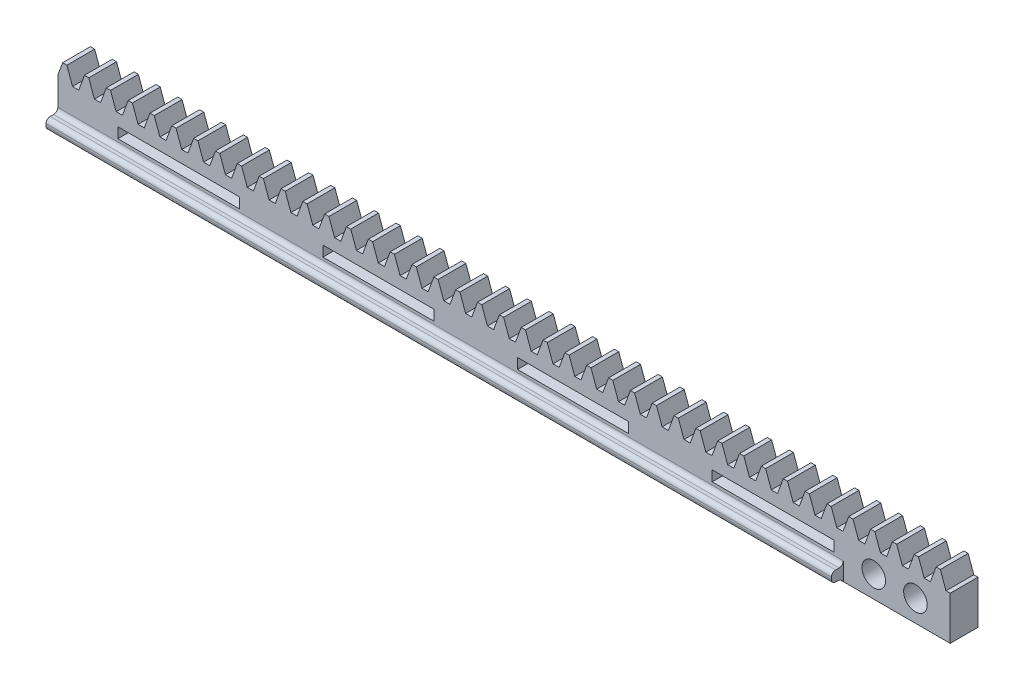
from build123d import *

# Parameters (mm, degrees)
BLANKSKE_W                      = 185.5
BLANKSKE_H                      = 7.5
BLANK_DEPTH                     = 4
TOOTHCUTSIM_DEPTH               = 186.694641818
TEETHCUTS_COUNT                 = 60
TEETHCUTS_PITCH                 = 3.14159265
BASE_LINE_W                     = 185.5
BASE_LINE_H                     = 1
BASE_DEPTH                      = 4
NOTCH_2_W                       = 103
NOTCH_2_H                       = 1.5
NOTCH_DEPTH                     = 186.694641818
FINAL_CUT_2_W                   = 49.706746588
FINAL_CUT_2_H                   = 22.249398493
FINAL_CUT_DEPTH                 = 10
RAIL_2_W                        = 113
RAIL_2_H                        = 1.5
RAIL_DEPTH                      = 1.7
VERRUNDUNG2_R                   = 1
VERRUNDUNG3_R                   = 0.6
VERRUNDUNG4_R                   = 0.6
VERRUNDUNG5_R                   = 0.6
FILLET_2_W                      = 12
FILLET_2_H                      = 1.5
FILLETO_DEPTH                   = 4
LINEARES_MUSTER1_COUNT          = 2
LINEARES_MUSTER1_PITCH          = 28
LINEARES_MUSTER2_COUNT          = 2
LINEARES_MUSTER2_PITCH          = 28
SKIZZE2_W                       = 16.998912502
SKIZZE2_H                       = 14.439985467
SCHNITT_LINEAR_AUSTRAGEN1_DEPTH = 139.646843329
SKIZZE3_R                       = 1.7
SCHNITT_LINEAR_AUSTRAGEN2_DEPTH = 139.646843329


with BuildPart() as part:
    # BlankSke → Blank (new body)
    with BuildSketch(Plane.XY):
        with Locations((92.75, 3.75)):
            Rectangle(BLANKSKE_W, BLANKSKE_H)
    extrude(amount=-BLANK_DEPTH)

    # TooCutSkeSim → ToothCutSim (cut, through all)
    with BuildSketch(Plane.XY):
        Polygon((0.44443537, 5.25), (-0.44443537, 5.25), (-1.272613241, 7.5254), (1.272613241, 7.5254), align=None)
    toothcutsim = extrude(amount=-TOOTHCUTSIM_DEPTH, mode=Mode.SUBTRACT)

    # TeethCuts: ToothCutSim ×60
    with Locations(*[(i * TEETHCUTS_PITCH, 0, 0) for i in range(1, TEETHCUTS_COUNT)]):
        add(toothcutsim, mode=Mode.SUBTRACT)

    # base-line → base (add)
    with BuildSketch(Plane.XY):
        with Locations((92.75, -0.5)):
            Rectangle(BASE_LINE_W, BASE_LINE_H)
    extrude(amount=-BASE_DEPTH)

    # notch 2 → notch (cut, through all)
    with BuildSketch(Plane.XY):
        with Locations((70.135961003, 2.75)):
            Rectangle(NOTCH_2_W, NOTCH_2_H)
    extrude(amount=-NOTCH_DEPTH, mode=Mode.SUBTRACT)

    # final cut 2 → final-cut (cut)
    with BuildSketch(Plane.XY):
        with Locations((163.239417262, 1.832076948)):
            Rectangle(FINAL_CUT_2_W, FINAL_CUT_2_H)
    extrude(amount=-FINAL_CUT_DEPTH, mode=Mode.SUBTRACT)

    # rail 2 → rail (add)
    with BuildSketch(Plane.XY):
        with Locations((66.5, 0.25)):
            Rectangle(RAIL_2_W, RAIL_2_H)
    extrude(amount=RAIL_DEPTH)

    # Verrundung2
    # the kernel refuses this fillet: 1 mm, written as the material it adds along each edge
    with BuildSketch(Plane(origin=(123, -0.5, 0), x_dir=(0, -1, 0), z_dir=(-1, 0, 0))) as verrundung2_piece_1:
        with BuildLine():
            CenterArc((1, 0.866025404), VERRUNDUNG2_R, 180, 60)
            Line((0, 0.866025404), (-0.02, 0.866025404))
            Line((-0.02, 0.866025404), (-0.02, 0))
            Line((-0.02, 0), (0, -0.02))
            ThreePointArc((0, -0.02), (0.25, -0.02), (0.49, -0.017320508))
            Line((0.49, -0.017320508), (0.5, 0))
        make_face()
    extrude(amount=113)

    # Verrundung3
    verrundung3_edges = [part.edges().sort_by_distance(p)[0] for p in [
        (66.5, -0.5, 1.7),
    ]]
    fillet(verrundung3_edges, radius=VERRUNDUNG3_R)

    # Verrundung4
    verrundung4_edges = [part.edges().sort_by_distance(p)[0] for p in [
        (66.5, 1, 0),
    ]]
    fillet(verrundung4_edges, radius=VERRUNDUNG4_R)

    # Verrundung5
    verrundung5_edges = [part.edges().sort_by_distance(p)[0] for p in [
        (66.5, 1, 1.7),
    ]]
    fillet(verrundung5_edges, radius=VERRUNDUNG5_R)

    # fillet 2 → filleto (add, through all)
    with BuildSketch(Plane.XY):
        with Locations((70.135961003, 2.75)):
            Rectangle(FILLET_2_W, FILLET_2_H)
    filleto = extrude(amount=-FILLETO_DEPTH)

    # Lineares Muster1: filleto ×2
    with Locations(*[(i * LINEARES_MUSTER1_PITCH, 0, 0) for i in range(1, LINEARES_MUSTER1_COUNT)]):
        add(filleto)

    # Lineares Muster2: filleto ×2
    with Locations(*[(-i * LINEARES_MUSTER2_PITCH, 0, 0) for i in range(1, LINEARES_MUSTER2_COUNT)]):
        add(filleto)

    # Skizze2 → Schnitt-Linear austragen1 (cut, through all)
    with BuildSketch(Plane.XY):
        with Locations((1.500543749, 6.219992734)):
            Rectangle(SKIZZE2_W, SKIZZE2_H)
    extrude(amount=-SCHNITT_LINEAR_AUSTRAGEN1_DEPTH, mode=Mode.SUBTRACT)

    # Skizze3 → Schnitt-Linear austragen2 (cut, through all)
    with BuildSketch(Plane.XY):
        with Locations((127.386043968, 2.125)):
            Circle(SKIZZE3_R)
        with Locations((133.386043968, 2.125)):
            Circle(SKIZZE3_R)
    extrude(amount=-SCHNITT_LINEAR_AUSTRAGEN2_DEPTH, mode=Mode.SUBTRACT)


solid = part.part
